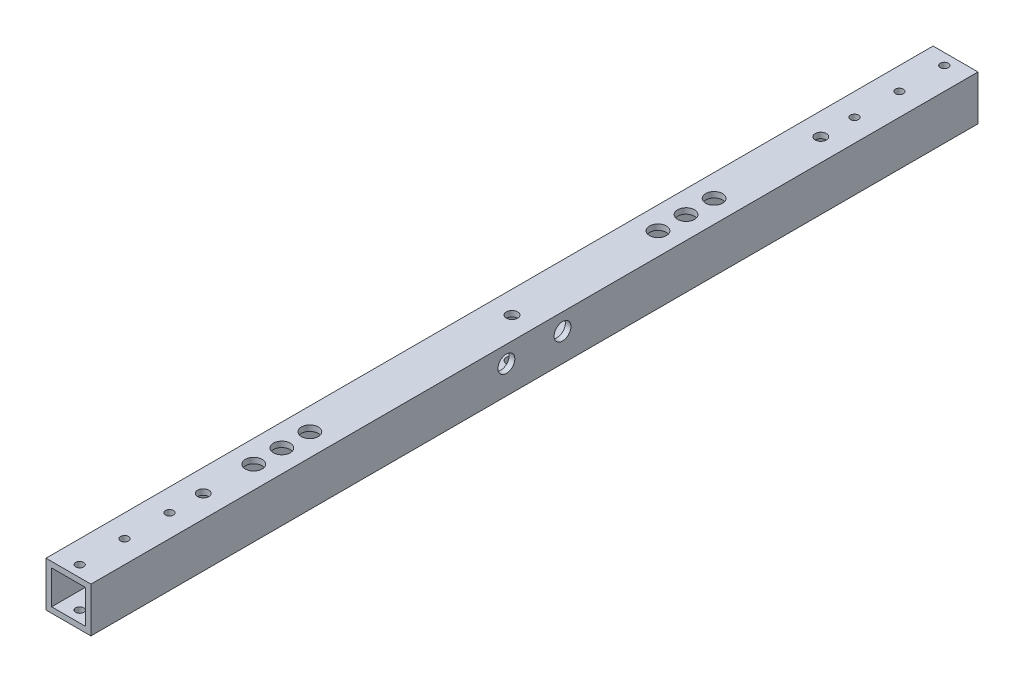
from build123d import *

# Parameters (mm, degrees)
SKETCH1_W                       = 25.4
SKETCH1_H                       = 25.4
SKETCH1_W_2                     = 19.05
SKETCH1_H_2                     = 19.05
EXTRUDE_THIN1_DEPTH             = 501.65
F_8_CLEARANCE_HOLE1_D           = 4.4958
F_1_4_0_25_DIAMETER_HOLE1_D     = 6.35
F_1_4_0_25_DIAMETER_HOLE1_DEPTH = 28.575
F_1_4_0_25_DIAMETER_HOLE1_TIP   = 1.907732465
F_3_8_0_375_DIAMETER_HOLE2_D    = 9.525
F_3_8_0_375_DIAMETER_HOLE4_D    = 9.525


with BuildPart() as part:
    # Sketch1 → Extrude-Thin1 (new body)
    with BuildSketch(Plane.XY):
        Rectangle(SKETCH1_W, SKETCH1_H)
        Rectangle(SKETCH1_W_2, SKETCH1_H_2, mode=Mode.SUBTRACT)
    extrude(amount=EXTRUDE_THIN1_DEPTH)

    # #8 Clearance Hole1 (through all)
    with Locations(Plane(origin=(0, 12.7, 495.3), x_dir=(0, 0, 1), z_dir=(0, 1, 0))):
        with Locations((0, 0), (-488.95, 0), (-463.55, 0), (-438.15, 0), (-25.4, 0), (-50.8, 0)):
            Hole(F_8_CLEARANCE_HOLE1_D / 2)

    # 1/4 (0.25) Diameter Hole1
    with Locations(Plane(origin=(381, 12.7, 250.825), x_dir=(1, 0, 0), z_dir=(0, 1, 0))):
        with Locations((-381, 174.625), (-381, 0), (-381, -174.625)):
            Hole(F_1_4_0_25_DIAMETER_HOLE1_D / 2, depth=F_1_4_0_25_DIAMETER_HOLE1_DEPTH)
            with Locations((0, 0, -(F_1_4_0_25_DIAMETER_HOLE1_DEPTH + F_1_4_0_25_DIAMETER_HOLE1_TIP / 2))):  # 118° drill point
                Cone(0, F_1_4_0_25_DIAMETER_HOLE1_D / 2, F_1_4_0_25_DIAMETER_HOLE1_TIP, mode=Mode.SUBTRACT)

    # 3/8 (0.375) Diameter Hole2 (through all)
    with Locations(Plane(origin=(381, 12.7, 250.825), x_dir=(1, 0, 0), z_dir=(0, 1, 0))):
        with Locations((-92.7735, 346.075), (-35.6235, 346.075), (35.6235, 346.075), (92.7735, 346.075), (-19.05, -346.775), (53.975, -346.775), (127, -346.775), (-381, -114.3), (-381, -130.175), (-381, -146.05), (-381, 114.3), (-381, 98.425), (-381, 82.55)):
            Hole(F_3_8_0_375_DIAMETER_HOLE2_D / 2)

    # 3/8 (0.375) Diameter Hole4 (through all)
    with Locations(Plane(origin=(12.7, -82.55, 250.825), x_dir=(0, 0, -1), z_dir=(1, 0, 0))):
        with Locations((-15.875, 85.725), (15.875, 85.725), (-15.875, 53.975), (15.875, 53.975)):
            Hole(F_3_8_0_375_DIAMETER_HOLE4_D / 2)


solid = part.part
